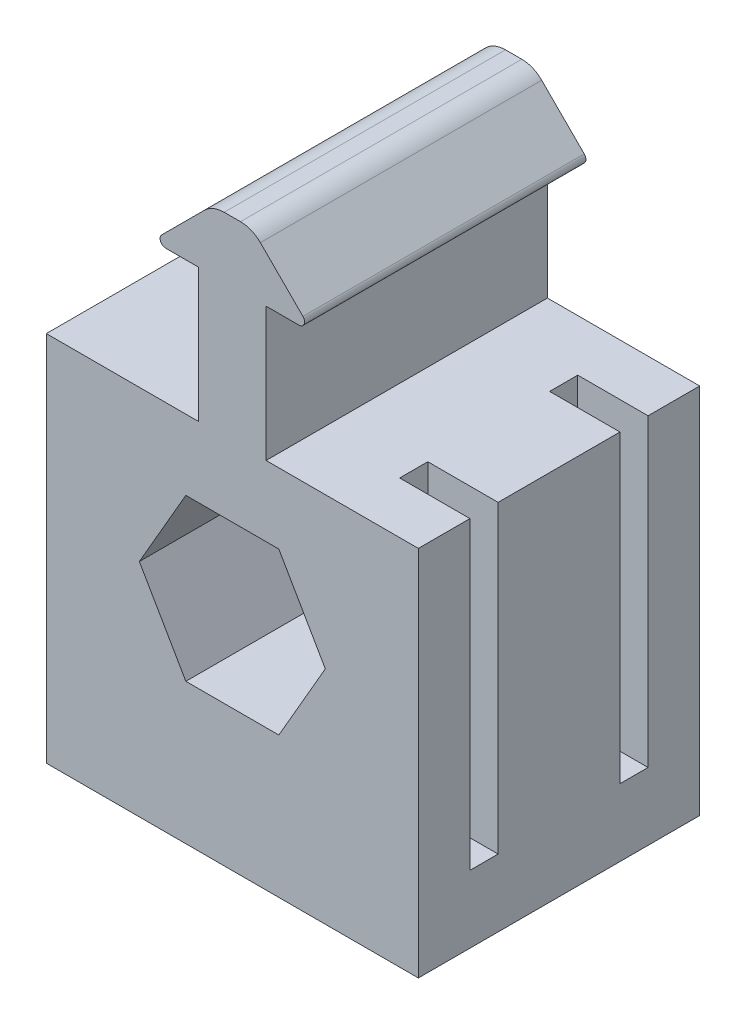
from build123d import *

# Parameters (mm, degrees)
BOSS_EXTRUDE1_DEPTH = 12.7
SKETCH8_W           = 2.54
SKETCH8_H           = 27.5
CUT_EXTRUDE1_DEPTH  = 6.35


with BuildPart() as part:
    # Sketch1 → Boss-Extrude1 (new, symmetric)
    with BuildSketch(Plane.XY):
        with BuildLine():
            Line((-16.79575, 13.62075), (-16.79575, -19.97075))
            Line((-16.79575, -19.97075), (16.79575, -19.97075))
            Line((16.79575, -19.97075), (16.79575, 13.62075))
            Line((16.79575, 13.62075), (3.048, 13.62075))
            Line((3.048, 13.62075), (3.048, 25.68575))
            Line((3.048, 25.68575), (6.01257951, 25.68575))
            ThreePointArc((6.01257951, 25.68575), (6.481910313, 25.999346816), (6.371789755, 26.552960245))
            Line((6.371789755, 26.552960245), (2.532108776, 30.392641224))
            ThreePointArc((2.532108776, 30.392641224), (1.70807347, 30.943244013), (0.736057552, 31.13659))
            Line((0.736057552, 31.13659), (-0.736057552, 31.13659))
            ThreePointArc((-0.736057552, 31.13659), (-1.70807347, 30.943244013), (-2.532108776, 30.392641224))
            Line((-2.532108776, 30.392641224), (-6.371789755, 26.552960245))
            ThreePointArc((-6.371789755, 26.552960245), (-6.481910313, 25.999346816), (-6.01257951, 25.68575))
            Line((-6.01257951, 25.68575), (-3.048, 25.68575))
            Line((-3.048, 25.68575), (-3.048, 13.62075))
            Line((-3.048, 13.62075), (-16.79575, 13.62075))
        make_face()
        Polygon((-4.19776947, 7.27075), (-8.395538939, 0), (-4.19776947, -7.27075), (4.19776947, -7.27075), (8.395538939, 0), (4.19776947, 7.27075), align=None, mode=Mode.SUBTRACT)
    extrude(amount=BOSS_EXTRUDE1_DEPTH, both=True)

    # Sketch8 → Cut-Extrude1 (cut)
    with BuildSketch(Plane(origin=(16.79575, 0, 0), x_dir=(0, 0, -1), z_dir=(1, 0, 0))):
        with Locations((-6.77, -0.12925)):
            Rectangle(SKETCH8_W, SKETCH8_H)
        with Locations((6.77, -0.12925)):
            Rectangle(SKETCH8_W, SKETCH8_H)
    extrude(amount=-CUT_EXTRUDE1_DEPTH, mode=Mode.SUBTRACT)


solid = part.part
